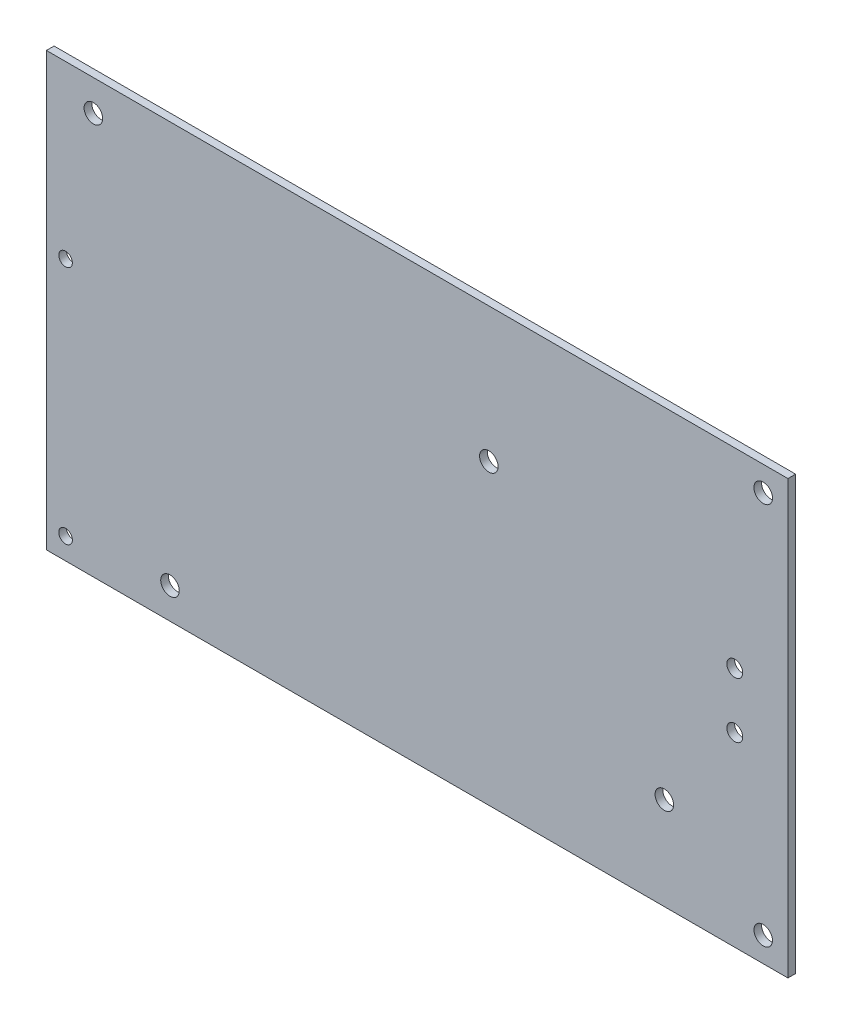
from build123d import *

# Parameters (mm, degrees)
SKETCH1_W          = 152.4
SKETCH1_H          = 88.9
EXTRUDE1_DEPTH     = 1.5748
SKETCH2_R          = 1.397
SKETCH2_R_2        = 1.905
CUT_EXTRUDE1_DEPTH = 1.5748
SKETCH3_R          = 1.6256
CUT_EXTRUDE2_DEPTH = 10
SKETCH4_R          = 1.905
CUT_EXTRUDE3_DEPTH = 10


with BuildPart() as part:
    # Sketch1 → Extrude1 (new body)
    with BuildSketch(Plane.XY):
        with Locations((76.2, -44.45)):
            Rectangle(SKETCH1_W, SKETCH1_H)
    extrude(amount=EXTRUDE1_DEPTH)

    # Sketch2 → Cut-Extrude1 (cut)
    with BuildSketch(Plane.XY.offset(1.5748)):
        with Locations((3.937, -84.4804)):
            Circle(SKETCH2_R)
        with Locations((3.937, -35.1536)):
            Circle(SKETCH2_R)
        with Locations((147.32, -83.82)):
            Circle(SKETCH2_R_2)
        with Locations((147.32, -5.08)):
            Circle(SKETCH2_R_2)
    extrude(amount=-CUT_EXTRUDE1_DEPTH, mode=Mode.SUBTRACT)

    # Sketch3 → Cut-Extrude2 (cut)
    with BuildSketch(Plane.XY.offset(1.5748)):
        with Locations((141.478, -50.673)):
            Circle(SKETCH3_R)
        with Locations((141.478, -39.243)):
            Circle(SKETCH3_R)
    extrude(amount=-CUT_EXTRUDE2_DEPTH, mode=Mode.SUBTRACT)

    # Sketch4 → Cut-Extrude3 (cut)
    with BuildSketch(Plane.XY.offset(1.5748)):
        with Locations((25.4, -82.55)):
            Circle(SKETCH4_R)
        with Locations((9.652, -6.35)):
            Circle(SKETCH4_R)
        with Locations((90.932, -27.686)):
            Circle(SKETCH4_R)
        with Locations((127, -69.85)):
            Circle(SKETCH4_R)
    extrude(amount=-CUT_EXTRUDE3_DEPTH, mode=Mode.SUBTRACT)


solid = part.part
